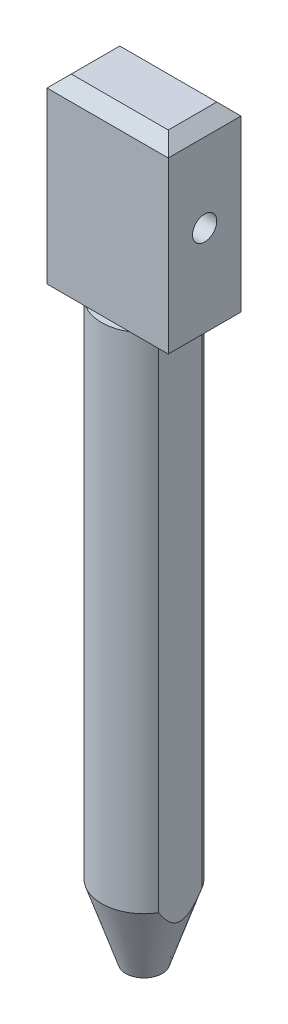
from build123d import *

# Parameters (mm, degrees)
CROQUIS2_W              = 20
CROQUIS2_H              = 12
SALIENTE_EXTRUIR1_DEPTH = 30
CHAFL_N1_SIZE           = 2
CROQUIS3_W              = 3
CROQUIS3_H              = 16
CORTAR_EXTRUIR1_DEPTH   = 95
CROQUIS4_R              = 2.6
CORTAR_EXTRUIR2_DEPTH   = 8
CROQUIS5_R              = 2
CORTAR_EXTRUIR3_DEPTH   = 112
CROQUIS6_R              = 2
CORTAR_EXTRUIR4_DEPTH   = 12
CROQUIS7_R              = 1.6
CORTAR_EXTRUIR5_DEPTH   = 4
CROQUIS8_R              = 1.6
CORTAR_EXTRUIR6_DEPTH   = 5


with BuildPart() as part:
    # Croquis1 → Revolución1 (revolve)
    with BuildSketch(Plane.XY):
        Polygon((0, 0), (3, 0), (7, 12), (7, 95), (0, 95), align=None)
    revolve(axis=Axis((0, 0, 0), (0, 1, 0)))

    # Croquis2 → Saliente-Extruir1 (add)
    with BuildSketch(Plane(origin=(0, 95, 0), x_dir=(1, 0, 0), z_dir=(0, 1, 0))):
        Rectangle(CROQUIS2_W, CROQUIS2_H)
    extrude(amount=SALIENTE_EXTRUIR1_DEPTH)

    # Chaflán1
    chafl_n1_edges = [part.edges().sort_by_distance(p)[0] for p in [
        (-10, 125, 0),
        (0, 125, 6),
        (10, 125, 0),
        (0, 125, -6),
    ]]
    chamfer(chafl_n1_edges, length=CHAFL_N1_SIZE)

    # Croquis3 → Cortar-Extruir1 (cut)
    with BuildSketch(Plane(origin=(0, 0, 0), x_dir=(1, 0, 0), z_dir=(0, 1, 0))):
        with Locations((7.5, 0)):
            Rectangle(CROQUIS3_W, CROQUIS3_H)
    extrude(amount=CORTAR_EXTRUIR1_DEPTH, mode=Mode.SUBTRACT)

    # Croquis4 → Cortar-Extruir2 (cut)
    with BuildSketch(Plane(origin=(0, 0, 0), x_dir=(1, 0, 0), z_dir=(0, 1, 0))):
        Circle(CROQUIS4_R)
    extrude(amount=CORTAR_EXTRUIR2_DEPTH, mode=Mode.SUBTRACT)

    # Croquis5 → Cortar-Extruir3 (cut)
    with BuildSketch(Plane(origin=(0, 0, 0), x_dir=(1, 0, 0), z_dir=(0, 1, 0))):
        Circle(CROQUIS5_R)
    extrude(amount=CORTAR_EXTRUIR3_DEPTH, mode=Mode.SUBTRACT)

    # Croquis6 → Cortar-Extruir4 (cut)
    with BuildSketch(Plane(origin=(0, 0, 0), x_dir=(0, 0, -1), z_dir=(1, 0, 0))):
        with Locations((0, 110)):
            Circle(CROQUIS6_R)
    extrude(amount=CORTAR_EXTRUIR4_DEPTH, mode=Mode.SUBTRACT)

    # Croquis7 → Cortar-Extruir5 (cut, symmetric)
    with BuildSketch(Plane.XY):
        with Locations((-4.5, 50)):
            Circle(CROQUIS7_R)
    extrude(amount=CORTAR_EXTRUIR5_DEPTH, both=True, mode=Mode.SUBTRACT)

    # Croquis8 → Cortar-Extruir6 (cut, symmetric)
    with BuildSketch(Plane.XY):
        with Locations((6, 115)):
            Circle(CROQUIS8_R)
    extrude(amount=CORTAR_EXTRUIR6_DEPTH, both=True, mode=Mode.SUBTRACT)


solid = part.part
